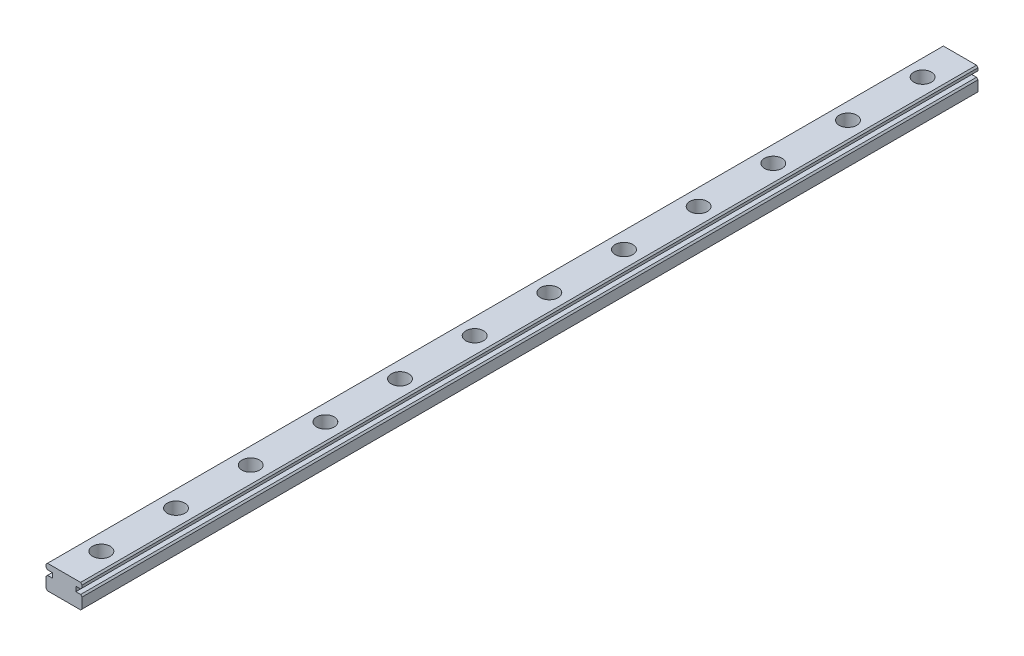
from build123d import *

# Parameters (mm, degrees)
BOSS_EXTRUDE1_DEPTH  = 300
CHAMFER1_SIZE        = 0.5
SKETCH2_R            = 2.95
CUT_EXTRUDE1_DEPTH   = 5.6
LPATTERN1_COUNT      = 6
LPATTERN1_PITCH      = 25
LPATTERN2_COUNT      = 7
LPATTERN2_PITCH      = 25
SKETCH3_R            = 1.6
CUT_EXTRUDE2_DEPTH   = 301.167624004
LPATTERN3_COUNT      = 7
LPATTERN3_PITCH      = 25
LPATTERN3_COUNT_DIR2 = 6
LPATTERN3_PITCH_DIR2 = 25


with BuildPart() as part:
    # Sketch1 → Boss-Extrude1 (new body)
    with BuildSketch(Plane.XY):
        Polygon((3.95, 2.1), (6.05, 2.1), (6.05, 4), (-6.05, 4), (-6.05, 2.1), (-3.95, 2.1), (-3.95, 0.5), (-6.05, 0.5), (-6.05, -4), (6.05, -4), (6.05, 0.5), (3.95, 0.5), align=None)
    extrude(amount=BOSS_EXTRUDE1_DEPTH)

    # Chamfer1
    chamfer1_edges = [part.edges().sort_by_distance(p)[0] for p in [
        (6.05, -4, 150),
        (-6.05, -4, 150),
        (-6.05, 0.5, 150),
        (-6.05, 2.1, 150),
        (-6.05, 4, 150),
        (6.05, 4, 150),
        (6.05, 2.1, 150),
        (6.05, 0.5, 150),
    ]]
    chamfer(chamfer1_edges, length=CHAMFER1_SIZE)

    # Sketch2 → Cut-Extrude1 (cut)
    with BuildSketch(Plane(origin=(0, 4, 0), x_dir=(1, 0, 0), z_dir=(0, 1, 0))):
        with Locations((0, -137.5)):
            Circle(SKETCH2_R)
        with Locations((0, -162.5)):
            Circle(SKETCH2_R)
    cut_extrude1 = extrude(amount=-CUT_EXTRUDE1_DEPTH, mode=Mode.SUBTRACT)

    # LPattern1: Cut-Extrude1 ×6
    with Locations(*[(0, 0, i * LPATTERN1_PITCH) for i in range(1, LPATTERN1_COUNT)]):
        add(cut_extrude1, mode=Mode.SUBTRACT)

    # LPattern2: Cut-Extrude1 ×7
    with Locations(*[(0, 0, -i * LPATTERN2_PITCH) for i in range(1, LPATTERN2_COUNT)]):
        add(cut_extrude1, mode=Mode.SUBTRACT)

    # Sketch3 → Cut-Extrude2 (cut, through all)
    with BuildSketch(Plane(origin=(0, 4, 0), x_dir=(1, 0, 0), z_dir=(0, 1, 0))):
        with Locations((0, -162.5)):
            Circle(SKETCH3_R)
        with Locations((0, -137.5)):
            Circle(SKETCH3_R)
    cut_extrude2 = extrude(amount=-CUT_EXTRUDE2_DEPTH, mode=Mode.SUBTRACT)

    # LPattern3: Cut-Extrude2 7 × 6
    with Locations(*[Vector(0, 0, -1) * (i * LPATTERN3_PITCH) + Vector(0, 0, 1) * (j * LPATTERN3_PITCH_DIR2) for i in range(LPATTERN3_COUNT) for j in range(LPATTERN3_COUNT_DIR2) if (i, j) != (0, 0)]):
        add(cut_extrude2, mode=Mode.SUBTRACT)


solid = part.part
